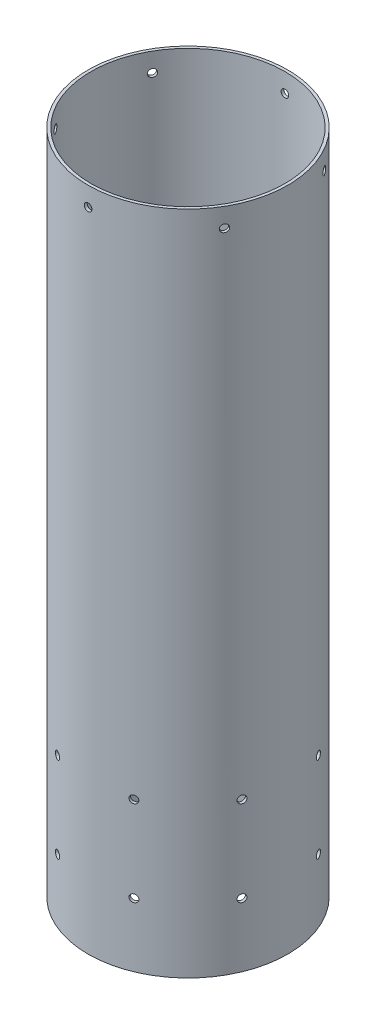
from build123d import *

# Parameters (mm, degrees)
SKETCH_1_R               = 52.5
SKETCH_1_R_2             = 51
EXTRUDE_1_DEPTH          = 350
SKETCH_2_R               = 2
CUT_EXTRUDE_1_DEPTH      = 64
PATTERN_CIRCULAR_1_COUNT = 6
SKETCH_6_R               = 2
CUT_EXTRUDE_3_DEPTH      = 140
PATTERN_CIRCULAR_2_COUNT = 8


with BuildPart() as part:
    # Эскиз1 → Бобышка-Вытянуть1 (new body)
    with BuildSketch(Plane(origin=(0, 0, 0), x_dir=(1, 0, 0), z_dir=(0, 1, 0))):
        Circle(SKETCH_1_R)
        Circle(SKETCH_1_R_2, mode=Mode.SUBTRACT)
    extrude(amount=EXTRUDE_1_DEPTH)

    # Эскиз2 → Вырез-Вытянуть1 (cut)
    with BuildSketch(Plane.XY):
        with Locations((0, 340)):
            Circle(SKETCH_2_R)
    cut_extrude_1 = extrude(amount=CUT_EXTRUDE_1_DEPTH, mode=Mode.SUBTRACT)

    # Круговой массив1: Вырез-Вытянуть1 ×6 about axis
    pattern_circular_1_axis = Axis((0, 350, 0), (0, -1, 0))
    for i in range(1, PATTERN_CIRCULAR_1_COUNT):
        add(cut_extrude_1.rotate(pattern_circular_1_axis, i * 360 / PATTERN_CIRCULAR_1_COUNT), mode=Mode.SUBTRACT)

    # Эскиз6 → Вырез-Вытянуть3 (cut)
    with BuildSketch(Plane(origin=(18.03122292, 0, 43.53122292), x_dir=(0.9238795325112877, 0, -0.3826834323650874), z_dir=(0.3826834323650874, 0, 0.9238795325112877))):
        with Locations((0, 33.5)):
            Circle(SKETCH_6_R)
        with Locations((0, 78.5)):
            Circle(SKETCH_6_R)
    cut_extrude_3 = extrude(amount=-CUT_EXTRUDE_3_DEPTH, mode=Mode.SUBTRACT)

    # Круговой массив2: Вырез-Вытянуть3 ×8 about axis
    pattern_circular_2_axis = Axis((0, 350, 0), (0, -1, 0))
    for i in range(1, PATTERN_CIRCULAR_2_COUNT):
        add(cut_extrude_3.rotate(pattern_circular_2_axis, i * 360 / PATTERN_CIRCULAR_2_COUNT), mode=Mode.SUBTRACT)


solid = part.part
